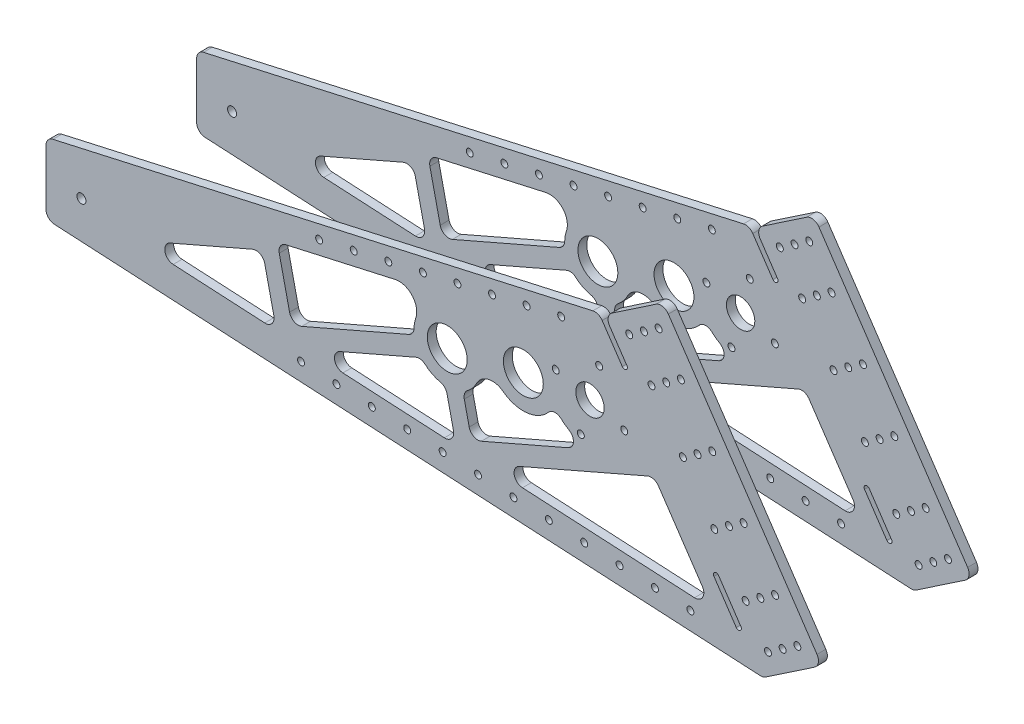
from build123d import *

# Parameters (mm, degrees)
BEARING_BLOCK_INTERFACE_PLATE_R   = 2.489199999999945
BEARING_BLOCK_INTERFACE_PLATE_R_2 = 2.4891999999999532
BEARING_BLOCK_INTERFACE_PLATE_R_3 = 2.4891999999998307
BOSS_EXTRUDE1_DEPTH               = 6.35
FILLET2_R                         = 6.35
PLATE_GB_R                        = 2.489199999999945
PLATE_GB_R_2                      = 2.4891999999998307
PLATE_GB_R_3                      = 14.287500000000026
PLATE_GB_R_4                      = 2.4891999999999532
PLATE_GB_R_5                      = 14.287500000000149
PLATE_GB_R_6                      = 2.4892000000000594
PLATE_GB_R_7                      = 10.159999999999924
PLATE_GB_R_8                      = 2.4891999999996024
BOSS_EXTRUDE2_DEPTH               = 6.35
FILLET1_R                         = 6.35
CUT_EXTRUDE1_REACH                = 774.478
TUBE_R                            = 3.2639000000000062
TUBE_R_2                          = 2.489199999999884
TUBE_R_3                          = 2.4891999999999532
TUBE_R_4                          = 2.4891999999999372
TUBE_R_5                          = 2.489199999999945
CUT_EXTRUDE2_REACH                = 774.478
FILLET3_R                         = 6.35


with BuildPart() as part:
    # bearing block interface plate → Boss-Extrude1 (new body)
    with BuildSketch(Plane.XY.offset(57.15000000000033)):
        Polygon((529.0514377657089, 336.1483946681548), (571.1665464508059, 364.5553941639975), (684.7945444360628, 196.0949594208139), (642.6794357509659, 167.6879599249711), align=None)
        with Locations((646.1064630479871, 185.31848697026268)):
            Circle(BEARING_BLOCK_INTERFACE_PLATE_R, mode=Mode.SUBTRACT)
        with Locations((656.635240219436, 192.42023684434122)):
            Circle(BEARING_BLOCK_INTERFACE_PLATE_R, mode=Mode.SUBTRACT)
        with Locations((667.164017390885, 199.5219867184198)):
            Circle(BEARING_BLOCK_INTERFACE_PLATE_R, mode=Mode.SUBTRACT)
        with Locations((567.7395191537848, 346.92486711870583)):
            Circle(BEARING_BLOCK_INTERFACE_PLATE_R_2, mode=Mode.SUBTRACT)
        with Locations((557.2107419823359, 339.8231172446273)):
            Circle(BEARING_BLOCK_INTERFACE_PLATE_R_2, mode=Mode.SUBTRACT)
        with Locations((546.6819648108869, 332.7213673705488)):
            Circle(BEARING_BLOCK_INTERFACE_PLATE_R_3, mode=Mode.SUBTRACT)
        with Locations((562.6609020275637, 309.03161873478854)):
            Circle(BEARING_BLOCK_INTERFACE_PLATE_R_3, mode=Mode.SUBTRACT)
        with Locations((573.189679199013, 316.133368608867)):
            Circle(BEARING_BLOCK_INTERFACE_PLATE_R_2, mode=Mode.SUBTRACT)
        with Locations((583.7184563704618, 323.2351184829455)):
            Circle(BEARING_BLOCK_INTERFACE_PLATE_R_2, mode=Mode.SUBTRACT)
        with Locations((606.2073309717106, 289.8939907733571)):
            Circle(BEARING_BLOCK_INTERFACE_PLATE_R_2, mode=Mode.SUBTRACT)
        with Locations((595.6785538002617, 282.7922408992787)):
            Circle(BEARING_BLOCK_INTERFACE_PLATE_R_2, mode=Mode.SUBTRACT)
        with Locations((585.1497766288124, 275.69049102520023)):
            Circle(BEARING_BLOCK_INTERFACE_PLATE_R_3, mode=Mode.SUBTRACT)
        with Locations((628.6962055729593, 256.55286306376865)):
            Circle(BEARING_BLOCK_INTERFACE_PLATE_R_2, mode=Mode.SUBTRACT)
        with Locations((618.1674284015103, 249.45111318969037)):
            Circle(BEARING_BLOCK_INTERFACE_PLATE_R_2, mode=Mode.SUBTRACT)
        with Locations((607.638651230061, 242.3493633156119)):
            Circle(BEARING_BLOCK_INTERFACE_PLATE_R_3, mode=Mode.SUBTRACT)
        with Locations((651.1850801742079, 223.21173535418063)):
            Circle(BEARING_BLOCK_INTERFACE_PLATE_R, mode=Mode.SUBTRACT)
        with Locations((640.656303002759, 216.1099854801021)):
            Circle(BEARING_BLOCK_INTERFACE_PLATE_R, mode=Mode.SUBTRACT)
        with Locations((630.1275258313098, 209.00823560602365)):
            Circle(BEARING_BLOCK_INTERFACE_PLATE_R_3, mode=Mode.SUBTRACT)
    extrude(amount=-BOSS_EXTRUDE1_DEPTH)

    # Fillet2
    fillet2_edges = [part.edges().sort_by_distance(p)[0] for p in [
        (642.6794357509659, 167.6879599249711, 53.975000000000335),
        (571.1665464508059, 364.5553941639975, 53.975000000000335),
        (529.0514377657089, 336.1483946681548, 53.975000000000335),
        (684.7945444360628, 196.0949594208139, 53.975000000000335),
    ]]
    fillet(fillet2_edges, radius=FILLET2_R)

    # plate+gb → Boss-Extrude2 (add)
    with BuildSketch(Plane.XY.offset(57.15000000000033)):
        with BuildLine():
            Line((128.73734233150986, 246.1260000000246), (128.73734233150986, 195.32600000002458))
            Line((128.73734233150986, 195.32600000002458), (642.6794357509659, 167.6879599249711))
            Line((642.6794357509659, 167.6879599249711), (684.7945444360628, 196.0949594208139))
            Line((684.7945444360628, 196.0949594208139), (571.1665464508058, 364.5553941639974))
            Line((571.1665464508058, 364.5553941639974), (529.0514377657089, 336.1483946681548))
            Line((529.0514377657089, 336.1483946681548), (545.0303749823858, 312.45864603239465))
            ThreePointArc((545.0303749823858, 312.4586460323946), (544.490685644217, 309.6821850803432), (541.7142246921655, 310.22187441851156))
            Line((541.7142246921655, 310.2218744185116), (524.8620284483795, 335.20628280326554))
            Line((524.8620284483795, 335.2062828032656), (128.73734233150986, 246.1260000000246))
        make_face()
        with Locations((646.1064630479871, 185.31848697026268)):
            Circle(PLATE_GB_R, mode=Mode.SUBTRACT)
        with BuildLine():
            ThreePointArc((607.4054110273914, 212.83068558260925), (607.94510036556, 215.60714653466047), (610.7215613176113, 215.06745719649211))
            Line((610.7215613176113, 215.0674571964921), (626.7004985342884, 191.37770856073158))
            ThreePointArc((626.7004985342884, 191.37770856073155), (626.1608091961198, 188.60124760867996), (623.3843482440682, 189.14093694684863))
            Line((623.3843482440683, 189.14093694684865), (607.4054110273914, 212.83068558260925))
        make_face(mode=Mode.SUBTRACT)
        with Locations((656.635240219436, 192.42023684434122)):
            Circle(PLATE_GB_R, mode=Mode.SUBTRACT)
        with Locations((667.164017390885, 199.5219867184198)):
            Circle(PLATE_GB_R, mode=Mode.SUBTRACT)
        with Locations((630.1275258313098, 209.00823560602365)):
            Circle(PLATE_GB_R_2, mode=Mode.SUBTRACT)
        with Locations((640.656303002759, 216.1099854801021)):
            Circle(PLATE_GB_R, mode=Mode.SUBTRACT)
        with Locations((416.28658066690326, 258.72124542384995)):
            Circle(PLATE_GB_R_3, mode=Mode.SUBTRACT)
        with Locations((511.9960146960638, 253.34148401228222)):
            Circle(PLATE_GB_R_4, mode=Mode.SUBTRACT)
        with Locations((651.1850801742079, 223.21173535418063)):
            Circle(PLATE_GB_R, mode=Mode.SUBTRACT)
        with Locations((607.638651230061, 242.3493633156119)):
            Circle(PLATE_GB_R_2, mode=Mode.SUBTRACT)
        with Locations((618.1674284015103, 249.45111318969037)):
            Circle(PLATE_GB_R_4, mode=Mode.SUBTRACT)
        with Locations((628.6962055729593, 256.55286306376865)):
            Circle(PLATE_GB_R_4, mode=Mode.SUBTRACT)
        with Locations((470.8050615222699, 270.9813288339667)):
            Circle(PLATE_GB_R_5, mode=Mode.SUBTRACT)
        with Locations((543.1045344294101, 271.3019962544207)):
            Circle(PLATE_GB_R_6, mode=Mode.SUBTRACT)
        with Locations((518.5700184416677, 277.8760000000246)):
            Circle(PLATE_GB_R_7, mode=Mode.SUBTRACT)
        with Locations((494.03550245392535, 284.45000374562846)):
            Circle(PLATE_GB_R_8, mode=Mode.SUBTRACT)
        with Locations((525.1440221872716, 302.410515987767)):
            Circle(PLATE_GB_R_2, mode=Mode.SUBTRACT)
        with Locations((585.1497766288124, 275.69049102520023)):
            Circle(PLATE_GB_R_2, mode=Mode.SUBTRACT)
        with Locations((595.6785538002617, 282.7922408992787)):
            Circle(PLATE_GB_R_4, mode=Mode.SUBTRACT)
        with Locations((606.2073309717106, 289.8939907733571)):
            Circle(PLATE_GB_R_4, mode=Mode.SUBTRACT)
        with Locations((562.6609020275637, 309.03161873478854)):
            Circle(PLATE_GB_R_2, mode=Mode.SUBTRACT)
        with Locations((573.189679199013, 316.133368608867)):
            Circle(PLATE_GB_R_4, mode=Mode.SUBTRACT)
        with Locations((583.7184563704618, 323.2351184829455)):
            Circle(PLATE_GB_R_4, mode=Mode.SUBTRACT)
        with Locations((546.6819648108869, 332.7213673705488)):
            Circle(PLATE_GB_R_2, mode=Mode.SUBTRACT)
        with Locations((557.2107419823359, 339.8231172446273)):
            Circle(PLATE_GB_R_4, mode=Mode.SUBTRACT)
        with Locations((567.7395191537848, 346.92486711870583)):
            Circle(PLATE_GB_R_4, mode=Mode.SUBTRACT)
    extrude(amount=-BOSS_EXTRUDE2_DEPTH)

    # Fillet1
    fillet1_edges = [part.edges().sort_by_distance(p)[0] for p in [
        (128.73734233150986, 195.32600000002458, 53.975000000000335),
        (128.73734233150986, 246.1260000000246, 53.975000000000335),
        (571.1665464508058, 364.5553941639974, 53.975000000000335),
        (642.6794357509659, 167.6879599249711, 53.975000000000335),
        (684.7945444360628, 196.0949594208139, 53.975000000000335),
        (529.0514377657089, 336.1483946681548, 53.975000000000335),
        (524.8620284483795, 335.2062828032656, 53.975000000000335),
    ]]
    fillet(fillet1_edges, radius=FILLET1_R)

    # tube → Cut-Extrude1 (cut, up to next)
    with BuildSketch(Plane.XY.offset(57.15000000000033), mode=Mode.PRIVATE) as cut_extrude1_sk1:
        with Locations((154.13734233150987, 220.7260000000245)):
            Circle(TUBE_R)
    cut_extrude1_tool1 = extrude(cut_extrude1_sk1.sketch, amount=-CUT_EXTRUDE1_REACH, mode=Mode.PRIVATE) & part.part
    # tube → Cut-Extrude1 (cut, up to next)
    with BuildSketch(Plane.XY.offset(57.15000000000033), mode=Mode.PRIVATE) as cut_extrude1_sk2:
        with Locations((497.93870328190997, 319.3889086085162)):
            Circle(TUBE_R_2)
    cut_extrude1_tool2 = extrude(cut_extrude1_sk2.sketch, amount=-CUT_EXTRUDE1_REACH, mode=Mode.PRIVATE) & part.part
    # tube → Cut-Extrude1 (cut, up to next)
    with BuildSketch(Plane.XY.offset(57.15000000000033), mode=Mode.PRIVATE) as cut_extrude1_sk3:
        with Locations((473.1575756203797, 313.8161434220995)):
            Circle(TUBE_R_3)
    cut_extrude1_tool3 = extrude(cut_extrude1_sk3.sketch, amount=-CUT_EXTRUDE1_REACH, mode=Mode.PRIVATE) & part.part
    # tube → Cut-Extrude1 (cut, up to next)
    with BuildSketch(Plane.XY.offset(57.15000000000033), mode=Mode.PRIVATE) as cut_extrude1_sk4:
        with Locations((448.3764479588494, 308.2433782356828)):
            Circle(TUBE_R_3)
    cut_extrude1_tool4 = extrude(cut_extrude1_sk4.sketch, amount=-CUT_EXTRUDE1_REACH, mode=Mode.PRIVATE) & part.part
    # tube → Cut-Extrude1 (cut, up to next)
    with BuildSketch(Plane.XY.offset(57.15000000000033), mode=Mode.PRIVATE) as cut_extrude1_sk5:
        with Locations((423.5953202973191, 302.67061304926614)):
            Circle(TUBE_R_3)
    cut_extrude1_tool5 = extrude(cut_extrude1_sk5.sketch, amount=-CUT_EXTRUDE1_REACH, mode=Mode.PRIVATE) & part.part
    # tube → Cut-Extrude1 (cut, up to next)
    with BuildSketch(Plane.XY.offset(57.15000000000033), mode=Mode.PRIVATE) as cut_extrude1_sk6:
        with Locations((398.8141926357888, 297.09784786284945)):
            Circle(TUBE_R_3)
    cut_extrude1_tool6 = extrude(cut_extrude1_sk6.sketch, amount=-CUT_EXTRUDE1_REACH, mode=Mode.PRIVATE) & part.part
    # tube → Cut-Extrude1 (cut, up to next)
    with BuildSketch(Plane.XY.offset(57.15000000000033), mode=Mode.PRIVATE) as cut_extrude1_sk7:
        with Locations((374.03306497425854, 291.52508267643276)):
            Circle(TUBE_R_4)
    cut_extrude1_tool7 = extrude(cut_extrude1_sk7.sketch, amount=-CUT_EXTRUDE1_REACH, mode=Mode.PRIVATE) & part.part
    # tube → Cut-Extrude1 (cut, up to next)
    with BuildSketch(Plane.XY.offset(57.15000000000033), mode=Mode.PRIVATE) as cut_extrude1_sk8:
        with Locations((590.5082808024525, 183.21189582536667)):
            Circle(TUBE_R_5)
    cut_extrude1_tool8 = extrude(cut_extrude1_sk8.sketch, amount=-CUT_EXTRUDE1_REACH, mode=Mode.PRIVATE) & part.part
    # tube → Cut-Extrude1 (cut, up to next)
    with BuildSketch(Plane.XY.offset(57.15000000000033), mode=Mode.PRIVATE) as cut_extrude1_sk9:
        with Locations((565.144928704245, 184.5758497624026)):
            Circle(TUBE_R_5)
    cut_extrude1_tool9 = extrude(cut_extrude1_sk9.sketch, amount=-CUT_EXTRUDE1_REACH, mode=Mode.PRIVATE) & part.part
    # tube → Cut-Extrude1 (cut, up to next)
    with BuildSketch(Plane.XY.offset(57.15000000000033), mode=Mode.PRIVATE) as cut_extrude1_sk10:
        with Locations((539.7815766060377, 185.93980369943853)):
            Circle(TUBE_R_5)
    cut_extrude1_tool10 = extrude(cut_extrude1_sk10.sketch, amount=-CUT_EXTRUDE1_REACH, mode=Mode.PRIVATE) & part.part
    # tube → Cut-Extrude1 (cut, up to next)
    with BuildSketch(Plane.XY.offset(57.15000000000033), mode=Mode.PRIVATE) as cut_extrude1_sk11:
        with Locations((514.4182245078301, 187.30375763647444)):
            Circle(TUBE_R_5)
    cut_extrude1_tool11 = extrude(cut_extrude1_sk11.sketch, amount=-CUT_EXTRUDE1_REACH, mode=Mode.PRIVATE) & part.part
    # tube → Cut-Extrude1 (cut, up to next)
    with BuildSketch(Plane.XY.offset(57.15000000000033), mode=Mode.PRIVATE) as cut_extrude1_sk12:
        with Locations((489.05487240962265, 188.66771157351036)):
            Circle(TUBE_R_5)
    cut_extrude1_tool12 = extrude(cut_extrude1_sk12.sketch, amount=-CUT_EXTRUDE1_REACH, mode=Mode.PRIVATE) & part.part
    # tube → Cut-Extrude1 (cut, up to next)
    with BuildSketch(Plane.XY.offset(57.15000000000033), mode=Mode.PRIVATE) as cut_extrude1_sk13:
        with Locations((463.6915203114152, 190.03166551054628)):
            Circle(TUBE_R_5)
    cut_extrude1_tool13 = extrude(cut_extrude1_sk13.sketch, amount=-CUT_EXTRUDE1_REACH, mode=Mode.PRIVATE) & part.part
    # tube → Cut-Extrude1 (cut, up to next)
    with BuildSketch(Plane.XY.offset(57.15000000000033), mode=Mode.PRIVATE) as cut_extrude1_sk14:
        with Locations((438.32816821320773, 191.39561944758222)):
            Circle(TUBE_R_5)
    cut_extrude1_tool14 = extrude(cut_extrude1_sk14.sketch, amount=-CUT_EXTRUDE1_REACH, mode=Mode.PRIVATE) & part.part
    # tube → Cut-Extrude1 (cut, up to next)
    with BuildSketch(Plane.XY.offset(57.15000000000033), mode=Mode.PRIVATE) as cut_extrude1_sk15:
        with Locations((412.96481611500025, 192.75957338461814)):
            Circle(TUBE_R_5)
    cut_extrude1_tool15 = extrude(cut_extrude1_sk15.sketch, amount=-CUT_EXTRUDE1_REACH, mode=Mode.PRIVATE) & part.part
    # tube → Cut-Extrude1 (cut, up to next)
    with BuildSketch(Plane.XY.offset(57.15000000000033), mode=Mode.PRIVATE) as cut_extrude1_sk16:
        with Locations((387.6014640167928, 194.12352732165405)):
            Circle(TUBE_R_5)
    cut_extrude1_tool16 = extrude(cut_extrude1_sk16.sketch, amount=-CUT_EXTRUDE1_REACH, mode=Mode.PRIVATE) & part.part
    # tube → Cut-Extrude1 (cut, up to next)
    with BuildSketch(Plane.XY.offset(57.15000000000033), mode=Mode.PRIVATE) as cut_extrude1_sk17:
        with Locations((362.23811191858533, 195.48748125868997)):
            Circle(TUBE_R_5)
    cut_extrude1_tool17 = extrude(cut_extrude1_sk17.sketch, amount=-CUT_EXTRUDE1_REACH, mode=Mode.PRIVATE) & part.part
    # tube → Cut-Extrude1 (cut, up to next)
    with BuildSketch(Plane.XY.offset(57.15000000000033), mode=Mode.PRIVATE) as cut_extrude1_sk18:
        with Locations((336.87475982037785, 196.8514351957259)):
            Circle(TUBE_R_5)
    cut_extrude1_tool18 = extrude(cut_extrude1_sk18.sketch, amount=-CUT_EXTRUDE1_REACH, mode=Mode.PRIVATE) & part.part
    # tube → Cut-Extrude1 (cut, up to next)
    with BuildSketch(Plane.XY.offset(57.15000000000033), mode=Mode.PRIVATE) as cut_extrude1_sk19:
        with Locations((311.5114077221704, 198.21538913276183)):
            Circle(TUBE_R_5)
    cut_extrude1_tool19 = extrude(cut_extrude1_sk19.sketch, amount=-CUT_EXTRUDE1_REACH, mode=Mode.PRIVATE) & part.part
    # tube → Cut-Extrude1 (cut, up to next)
    with BuildSketch(Plane.XY.offset(57.15000000000033), mode=Mode.PRIVATE) as cut_extrude1_sk20:
        with Locations((349.2519373127282, 285.952317490016)):
            Circle(TUBE_R_4)
    cut_extrude1_tool20 = extrude(cut_extrude1_sk20.sketch, amount=-CUT_EXTRUDE1_REACH, mode=Mode.PRIVATE) & part.part
    # tube → Cut-Extrude1 (cut, up to next)
    with BuildSketch(Plane.XY.offset(57.15000000000033), mode=Mode.PRIVATE) as cut_extrude1_sk21:
        with Locations((324.47080965119795, 280.37955230359927)):
            Circle(TUBE_R_3)
    cut_extrude1_tool21 = extrude(cut_extrude1_sk21.sketch, amount=-CUT_EXTRUDE1_REACH, mode=Mode.PRIVATE) & part.part
    add(cut_extrude1_tool1.solids().sort_by_distance((154.137342, 220.726, 57.15))[0], mode=Mode.SUBTRACT)
    add(cut_extrude1_tool2.solids().sort_by_distance((497.938703, 319.388909, 57.15))[0], mode=Mode.SUBTRACT)
    add(cut_extrude1_tool3.solids().sort_by_distance((473.157576, 313.816143, 57.15))[0], mode=Mode.SUBTRACT)
    add(cut_extrude1_tool4.solids().sort_by_distance((448.376448, 308.243378, 57.15))[0], mode=Mode.SUBTRACT)
    add(cut_extrude1_tool5.solids().sort_by_distance((423.59532, 302.670613, 57.15))[0], mode=Mode.SUBTRACT)
    add(cut_extrude1_tool6.solids().sort_by_distance((398.814193, 297.097848, 57.15))[0], mode=Mode.SUBTRACT)
    add(cut_extrude1_tool7.solids().sort_by_distance((374.033065, 291.525083, 57.15))[0], mode=Mode.SUBTRACT)
    add(cut_extrude1_tool8.solids().sort_by_distance((590.508281, 183.211896, 57.15))[0], mode=Mode.SUBTRACT)
    add(cut_extrude1_tool9.solids().sort_by_distance((565.144929, 184.57585, 57.15))[0], mode=Mode.SUBTRACT)
    add(cut_extrude1_tool10.solids().sort_by_distance((539.781577, 185.939804, 57.15))[0], mode=Mode.SUBTRACT)
    add(cut_extrude1_tool11.solids().sort_by_distance((514.418225, 187.303758, 57.15))[0], mode=Mode.SUBTRACT)
    add(cut_extrude1_tool12.solids().sort_by_distance((489.054872, 188.667712, 57.15))[0], mode=Mode.SUBTRACT)
    add(cut_extrude1_tool13.solids().sort_by_distance((463.69152, 190.031666, 57.15))[0], mode=Mode.SUBTRACT)
    add(cut_extrude1_tool14.solids().sort_by_distance((438.328168, 191.395619, 57.15))[0], mode=Mode.SUBTRACT)
    add(cut_extrude1_tool15.solids().sort_by_distance((412.964816, 192.759573, 57.15))[0], mode=Mode.SUBTRACT)
    add(cut_extrude1_tool16.solids().sort_by_distance((387.601464, 194.123527, 57.15))[0], mode=Mode.SUBTRACT)
    add(cut_extrude1_tool17.solids().sort_by_distance((362.238112, 195.487481, 57.15))[0], mode=Mode.SUBTRACT)
    add(cut_extrude1_tool18.solids().sort_by_distance((336.87476, 196.851435, 57.15))[0], mode=Mode.SUBTRACT)
    add(cut_extrude1_tool19.solids().sort_by_distance((311.511408, 198.215389, 57.15))[0], mode=Mode.SUBTRACT)
    add(cut_extrude1_tool20.solids().sort_by_distance((349.251937, 285.952317, 57.15))[0], mode=Mode.SUBTRACT)
    add(cut_extrude1_tool21.solids().sort_by_distance((324.47081, 280.379552, 57.15))[0], mode=Mode.SUBTRACT)

    # Sketch20 → Cut-Extrude2 (cut, up to next)
    with BuildSketch(Plane.XY.offset(57.15000000000033), mode=Mode.PRIVATE) as cut_extrude2_sk1:
        Polygon((283.7782182408136, 253.59394234449184), (193.02712039136657, 214.1258298591775), (293.87334152601755, 208.70266655571493), align=None)
    cut_extrude2_tool1 = extrude(cut_extrude2_sk1.sketch, amount=-CUT_EXTRUDE2_REACH, mode=Mode.PRIVATE) & part.part
    # Sketch20 → Cut-Extrude2 (cut, up to next)
    with BuildSketch(Plane.XY.offset(57.15000000000033), mode=Mode.PRIVATE) as cut_extrude2_sk2:
        with BuildLine():
            Line((397.7730730126499, 243.7450913586069), (314.6314269698162, 207.58636803741302))
            Line((314.6314269698162, 207.58636803741308), (422.5826597553713, 201.78112161747538))
            Line((422.58265975537137, 201.7811216174754), (415.1265819839163, 234.93701620982114))
            ThreePointArc((415.126581983916, 234.93701620982102), (405.5089529197121, 237.48735985401194), (397.77307301264995, 243.74509135860666))
        make_face()
    cut_extrude2_tool2 = extrude(cut_extrude2_sk2.sketch, amount=-CUT_EXTRUDE2_REACH, mode=Mode.PRIVATE) & part.part
    # Sketch20 → Cut-Extrude2 (cut, up to next)
    with BuildSketch(Plane.XY.offset(57.15000000000033), mode=Mode.PRIVATE) as cut_extrude2_sk3:
        with BuildLine():
            Line((304.9718820421919, 217.2344544602027), (392.70805195930586, 255.3913595046347))
            ThreePointArc((392.7080519593054, 255.39135950463523), (392.57852746394303, 260.94910753260035), (393.741172300006, 266.38542951740084))
            ThreePointArc((393.7411723000059, 266.38542951740084), (391.16240743211694, 278.96260089462623), (378.93057191111905, 282.86355819805976))
            Line((378.93057191111905, 282.8635581980597), (294.4837853667419, 263.87321528118673))
            Line((294.483785366742, 263.87321528118673), (304.9718820421919, 217.2344544602027))
        make_face()
    cut_extrude2_tool3 = extrude(cut_extrude2_sk3.sketch, amount=-CUT_EXTRUDE2_REACH, mode=Mode.PRIVATE) & part.part
    # Sketch20 → Cut-Extrude2 (cut, up to next)
    with BuildSketch(Plane.XY.offset(57.15000000000033), mode=Mode.PRIVATE) as cut_extrude2_sk4:
        Polygon((564.6938350728718, 253.44189704181008), (443.3407451991701, 200.66482309917347), (606.1997655838906, 191.9068245043722), align=None)
    cut_extrude2_tool4 = extrude(cut_extrude2_sk4.sketch, amount=-CUT_EXTRUDE2_REACH, mode=Mode.PRIVATE) & part.part
    # Sketch20 → Cut-Extrude2 (cut, up to next)
    with BuildSketch(Plane.XY.offset(57.15000000000033), mode=Mode.PRIVATE) as cut_extrude2_sk5:
        with BuildLine():
            ThreePointArc((437.4277117876691, 247.7627906429703), (433.232938002764, 241.99234440509446), (427.5171458146811, 237.7233988030291))
            Line((427.51714581468167, 237.72339880302906), (433.6812002715457, 210.31290952196312))
            Line((433.6812002715457, 210.31290952196312), (519.7296081727479, 247.7357983101625))
            ThreePointArc((519.7296081727479, 247.73579831016238), (504.36792965000797, 251.2662822224191), (492.8846159595747, 262.0634573334294))
            ThreePointArc((492.88461595957466, 262.0634573334294), (477.11936489850655, 248.0212606911487), (456.39066165040543, 252.02716748127182))
            ThreePointArc((456.39066165040543, 252.0271674812718), (445.9165991255359, 254.30884525726637), (437.4277117876691, 247.7627906429703))
        make_face()
    cut_extrude2_tool5 = extrude(cut_extrude2_sk5.sketch, amount=-CUT_EXTRUDE2_REACH, mode=Mode.PRIVATE) & part.part
    add(cut_extrude2_tool1.solids().sort_by_distance((256.892893, 225.474146, 57.15))[0], mode=Mode.SUBTRACT)
    add(cut_extrude2_tool2.solids().sort_by_distance((381.543889, 218.429138, 57.15))[0], mode=Mode.SUBTRACT)
    add(cut_extrude2_tool3.solids().sort_by_distance((342.159835, 254.458367, 57.15))[0], mode=Mode.SUBTRACT)
    add(cut_extrude2_tool4.solids().sort_by_distance((538.078115, 215.337848, 57.15))[0], mode=Mode.SUBTRACT)
    add(cut_extrude2_tool5.solids().sort_by_distance((463.243993, 237.371256, 57.15))[0], mode=Mode.SUBTRACT)

    # Fillet3
    fillet3_edges = [part.edges().sort_by_distance(p)[0] for p in [
        (392.70805195930564, 255.39135950463498, 53.975000000000335),
        (304.9718820421919, 217.2344544602027, 53.975000000000335),
        (294.4837853667419, 263.87321528118673, 53.975000000000335),
        (492.8846159595747, 262.0634573334294, 53.975000000000335),
        (519.7296081727479, 247.73579831016247, 53.975000000000335),
        (433.6812002715457, 210.31290952196312, 53.975000000000335),
        (427.5171458146814, 237.72339880302908, 53.975000000000335),
        (564.6938350728717, 253.44189704181005, 53.975000000000335),
        (606.1997655838906, 191.9068245043722, 53.975000000000335),
        (443.3407451991701, 200.66482309917347, 53.975000000000335),
        (415.12658198391614, 234.93701620982108, 53.975000000000335),
        (422.5826597553713, 201.78112161747538, 53.975000000000335),
        (314.6314269698162, 207.58636803741305, 53.975000000000335),
        (397.7730730126499, 243.74509135860677, 53.975000000000335),
        (283.7782182408136, 253.59394234449184, 53.975000000000335),
        (293.8733415260176, 208.70266655571493, 53.975000000000335),
        (193.02712039136657, 214.12582985917754, 53.975000000000335),
    ]]
    fillet(fillet3_edges, radius=FILLET3_R)


with BuildPart() as body_2:
    # Mirror1: mirrored copy
    add(part.part.mirror(Plane.XY))


solid = Compound([part.part, body_2.part])
